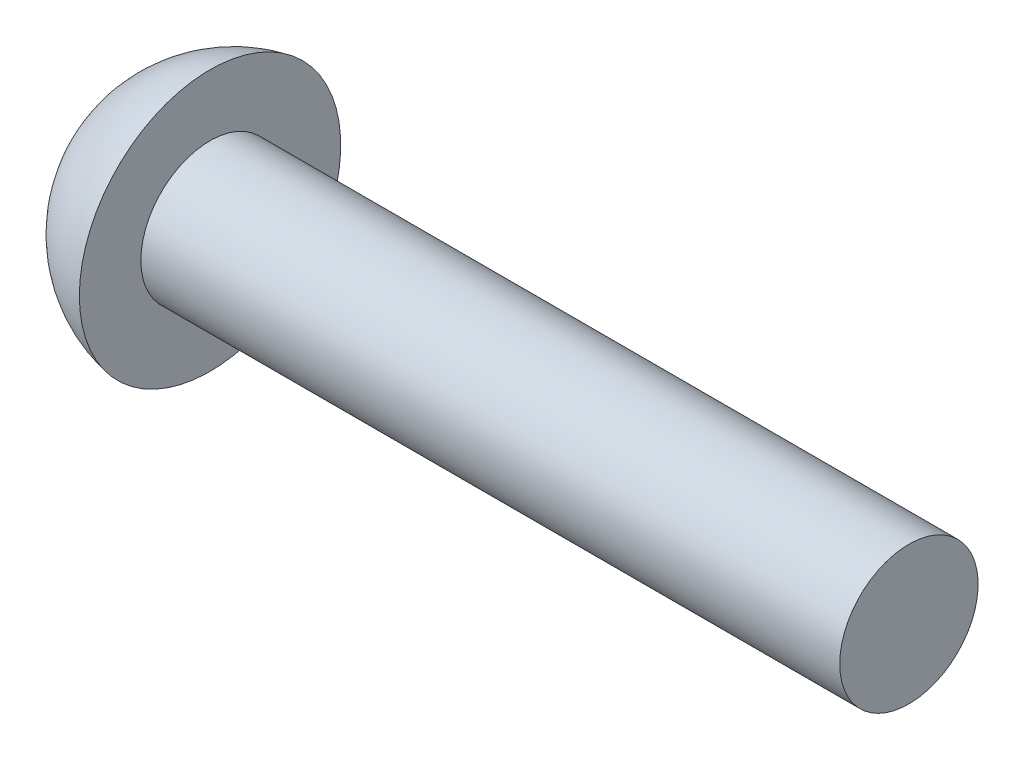
from build123d import *

# Parameters (mm, degrees)
CIRPATTERN1_COUNT = 2
CIRPATTERN1_ANGLE = 90


# Read off the part's stored shape, not the designer's step: ThreadSchematic
with BuildPart() as part:
    # ThreadSchematic outline → ThreadSchematic (revolve)
    with BuildSketch(Plane.YX):
        with BuildLine():
            Line((0, 14.6812), (0, 0))
            ThreePointArc((0, 0), (1.546391238, 0.560330696), (2.3749, 1.981200001))
            Line((2.3749, 1.981200001), (1.2573, 1.9812))
            Line((1.2573, 1.9812), (1.2573, 14.6812))
            Line((1.2573, 14.6812), (0, 14.6812))
        make_face()
    revolve(axis=Axis((0, 0, 0), (1, 0, 0)))

    # Sketch3 → Cross section 0
    with BuildSketch(Plane(origin=(0, 0, 0), x_dir=(0, 0, -1), z_dir=(1, 0, 0))):
        with BuildLine():
            Line((0.3429, -1.5494), (-0.3429, -1.5494))
            Line((-0.3429, -1.5494), (-0.3429, 1.5494))
            Line((-0.3429, 1.5494), (0.3429, 1.5494))
            Line((0.3429, 1.5494), (0.3429, -1.5494))
        make_face()
    # Sketch4 → Cross section 1
    with BuildSketch(Plane(origin=(1.7018, 0, 0), x_dir=(0, 0, -1), z_dir=(1, 0, 0))):
        with BuildLine():
            Line((0.17145, -0.17145), (-0.17145, -0.17145))
            Line((-0.17145, -0.17145), (-0.17145, 0.17145))
            Line((-0.17145, 0.17145), (0.17145, 0.17145))
            Line((0.17145, 0.17145), (0.17145, -0.17145))
        make_face()
    cross = loft(mode=Mode.SUBTRACT)

    # CirPattern1: Cross ×2 about axis
    cirpattern1_axis = Axis((0, 0, 0), (1, 0, 0))
    for i in range(1, CIRPATTERN1_COUNT):
        add(cross.rotate(cirpattern1_axis, i * CIRPATTERN1_ANGLE / (CIRPATTERN1_COUNT - 1)), mode=Mode.SUBTRACT)


solid = part.part
